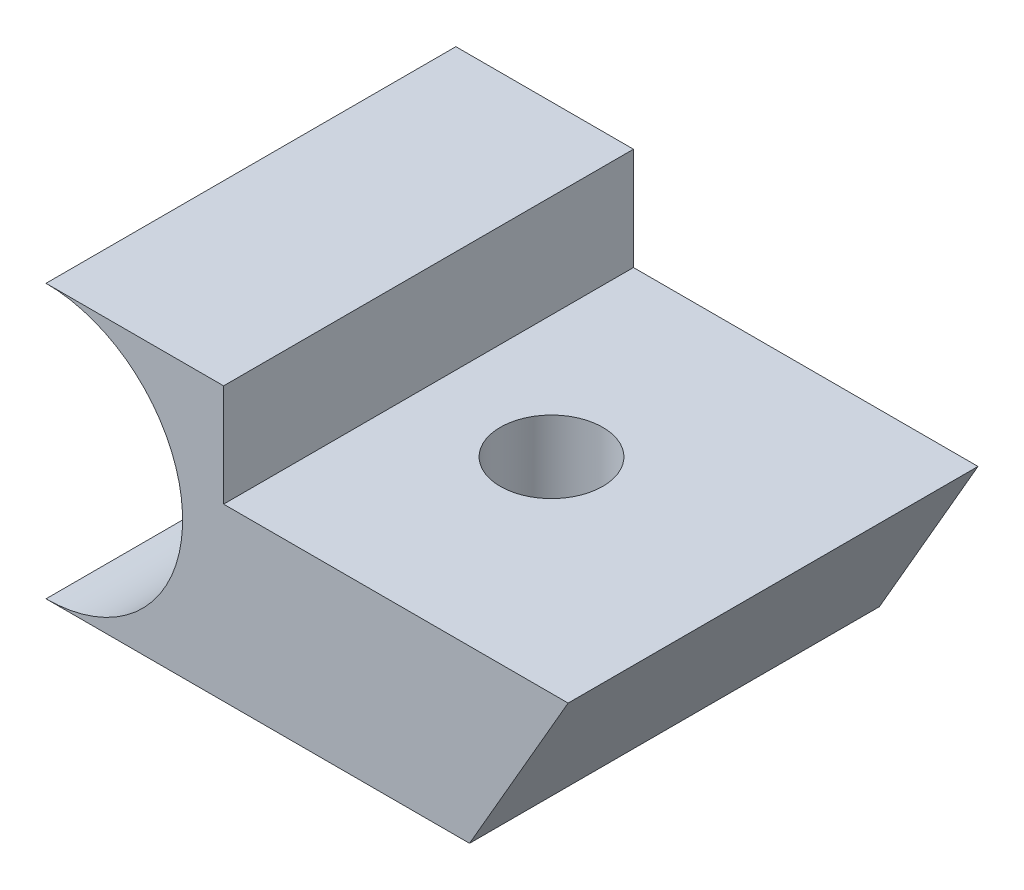
from build123d import *

# Parameters (mm, degrees)
BOSS_EXTRUDE1_DEPTH          = 38.1
CHAMFER1_SIZE                = 11.43
CHAMFER1_SIZE_2              = 19.797340731
F_3_8_0_375_DIAMETER_HOLE1_D = 9.525


with BuildPart() as part:
    # Sketch1 → Boss-Extrude1 (new body)
    with BuildSketch(Plane.XY):
        with BuildLine():
            Line((0, 0), (50.8, 0))
            Line((50.8, 0), (50.8, 15.875))
            Line((50.8, 15.875), (16.51, 15.875))
            Line((16.51, 15.875), (16.51, 25.4))
            Line((16.51, 25.4), (0, 25.4))
            ThreePointArc((0, 25.4), (12.7, 12.7), (0, 0))
        make_face()
    extrude(amount=BOSS_EXTRUDE1_DEPTH)

    # Chamfer1
    # the kernel refuses this chamfer: 19.797340731, 11.43 mm, written as the material it takes off along each edge
    with BuildSketch(Plane(origin=(50.8, 0, -51.217418184), x_dir=(-0.9983227437537926, -0.05789386240267138, 0), z_dir=(0, 0, 1))) as chamfer1_piece_1:
        Polygon((CHAMFER1_SIZE * 0.998322743754, -CHAMFER1_SIZE * 0.0578938624027), (-CHAMFER1_SIZE_2 * 0.0578938624012, -CHAMFER1_SIZE_2 * 0.998322743729), (0, 0), align=None)
    extrude(amount=140.534836368, mode=Mode.SUBTRACT)

    # 3/8 (0.375) Diameter Hole1 (through all)
    with Locations(Plane(origin=(0, 25.4, 0), x_dir=(1, 0, 0), z_dir=(0, 1, 0))):
        with Locations((27.939997923, -19.05)):
            Hole(F_3_8_0_375_DIAMETER_HOLE1_D / 2)


solid = part.part
